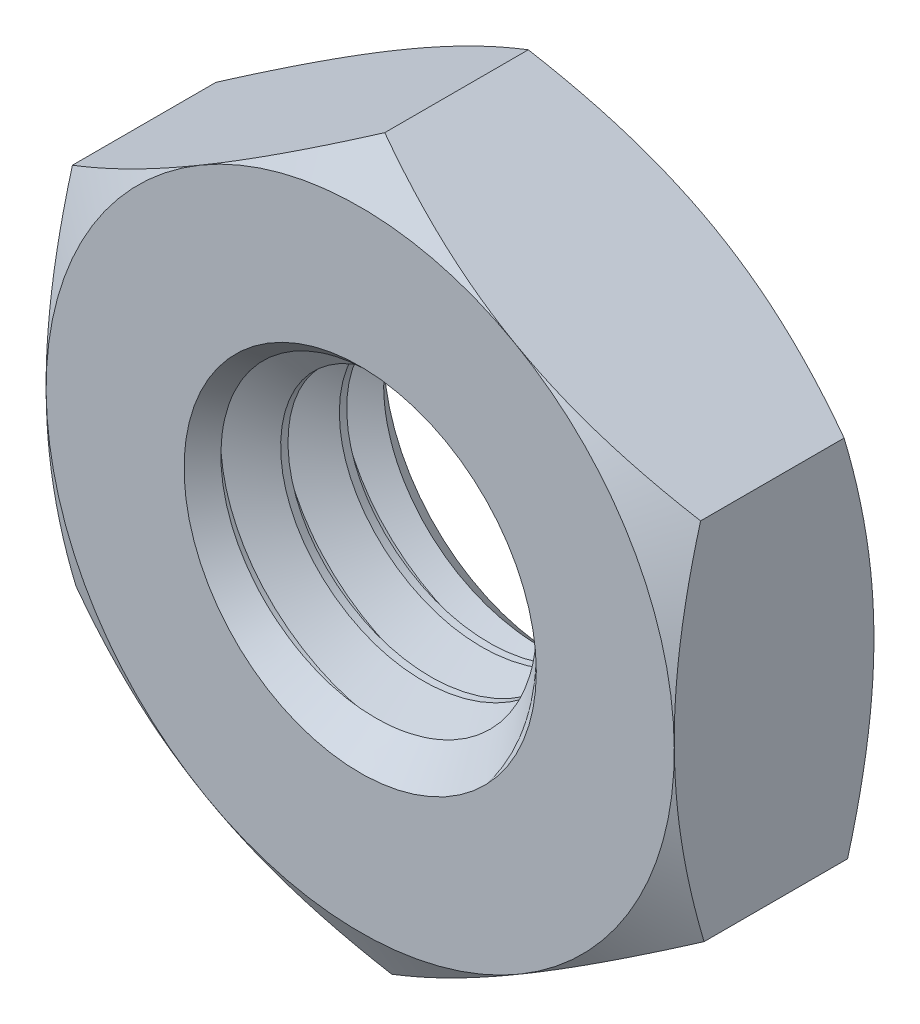
from build123d import *

# Parameters (mm, degrees)
BASE_DEPTH                                 = 0.85
SKETCH3_OUTSIDE_W                          = 14.942
SKETCH3_OUTSIDE_H                          = 15.74
SKETCH3_OUTSIDE_R                          = 2.675
POINT_ROUNDINGS_DEPTH                      = 1.7
POINT_ROUNDINGS_DRAFT                      = -60
SKETCH10_R                                 = 1.5
FUNNEL_CUT_DEPTH                           = 0.85
FUNNEL_CUT_DRAFT                           = -45
MIRROR_FOR_POINT_ROUNDINGS_COPY_1_SKETCH_W = 14.942
MIRROR_FOR_POINT_ROUNDINGS_COPY_1_SKETCH_H = 15.74
MIRROR_FOR_POINT_ROUNDINGS_COPY_1_SKETCH_R = 2.675
MIRROR_FOR_POINT_ROUNDINGS_COPY_1_DEPTH    = 1.7
MIRROR_FOR_POINT_ROUNDINGS_COPY_1_DRAFT    = -60
MIRROR_FOR_POINT_ROUNDINGS_COPY_2_SKETCH_R = 1.5
MIRROR_FOR_POINT_ROUNDINGS_COPY_2_DEPTH    = 0.85
MIRROR_FOR_POINT_ROUNDINGS_COPY_2_DRAFT    = -45
SKETCH4_R                                  = 1.5
PLUG_DEPTH                                 = 1.7
SWEEP_CUT_PITCH                            = 0.5


with BuildPart() as part:
    # Sketch1 → Base (new, symmetric)
    with BuildSketch(Plane.XY):
        Polygon((-2.689690292, 1.518683466), (-2.660063607, -1.569998388), (0.029626684, -3.088681854), (2.689690292, -1.518683466), (2.660063607, 1.569998388), (-0.029626684, 3.088681854), align=None)
    extrude(amount=BASE_DEPTH, both=True)


with BuildPart() as point_roundings_tool:
    # Sketch3 outside → Point roundings (with draft: the straight prism first)
    with BuildSketch(Plane.XY.offset(0.85)):
        Rectangle(SKETCH3_OUTSIDE_W, SKETCH3_OUTSIDE_H)
        Circle(SKETCH3_OUTSIDE_R, mode=Mode.SUBTRACT)
    extrude(amount=-POINT_ROUNDINGS_DEPTH)
    # Point roundings: the draft: its side faces are tilted about the plane it starts from
    point_roundings_sides = [point_roundings_tool.faces().sort_by_distance(p)[0] for p in [
        (0, -7.87, 0),
        (7.471, 0, 0),
        (0, 7.87, 0),
        (-7.471, 0, 0),
        (-2.675, 0, 0),
    ]]
    draft(point_roundings_sides, Plane.XY.offset(0.85), POINT_ROUNDINGS_DRAFT)


with BuildPart() as part_1:
    add(part.part)

    # Point roundings: cut by point_roundings_tool
    add(point_roundings_tool.part, mode=Mode.SUBTRACT)


with BuildPart() as funnel_cut_tool:
    # Sketch10 → Funnel cut (with draft: the straight prism first)
    with BuildSketch(Plane.XY.offset(0.85)):
        Circle(SKETCH10_R)
    extrude(amount=-FUNNEL_CUT_DEPTH)
    # Funnel cut: the draft: its side faces are tilted about the plane it starts from
    funnel_cut_sides = [funnel_cut_tool.faces().sort_by_distance(p)[0] for p in [
        (-1.5, 0, 0.425),
    ]]
    draft(funnel_cut_sides, Plane.XY.offset(0.85), FUNNEL_CUT_DRAFT)


with BuildPart() as part_2:
    add(part_1.part)

    # Funnel cut: cut by funnel_cut_tool
    add(funnel_cut_tool.part, mode=Mode.SUBTRACT)


with BuildPart() as mirror_for_point_roundings_copy_1_tool:
    # Mirror for point roundings copy 1 sketch → Mirror for point roundings copy 1 (with draft: the straight prism first)
    with BuildSketch(Plane(origin=(0, 0, -0.85), x_dir=(1, 0, 0), z_dir=(0, 0, -1))):
        Rectangle(MIRROR_FOR_POINT_ROUNDINGS_COPY_1_SKETCH_W, MIRROR_FOR_POINT_ROUNDINGS_COPY_1_SKETCH_H)
        Circle(MIRROR_FOR_POINT_ROUNDINGS_COPY_1_SKETCH_R, mode=Mode.SUBTRACT)
    extrude(amount=-MIRROR_FOR_POINT_ROUNDINGS_COPY_1_DEPTH)
    # Mirror for point roundings copy 1: the draft: its side faces are tilted about the plane it starts from
    mirror_for_point_roundings_copy_1_sides = [mirror_for_point_roundings_copy_1_tool.faces().sort_by_distance(p)[0] for p in [
        (0, -7.87, 0),
        (7.471, 0, 0),
        (0, 7.87, 0),
        (-7.471, 0, 0),
        (-2.675, 0, 0),
    ]]
    draft(mirror_for_point_roundings_copy_1_sides, Plane(origin=(0, 0, -0.85), x_dir=(1, 0, 0), z_dir=(0, 0, -1)), MIRROR_FOR_POINT_ROUNDINGS_COPY_1_DRAFT)


with BuildPart() as part_3:
    add(part_2.part)

    # Mirror for point roundings copy 1: cut by mirror_for_point_roundings_copy_1_tool
    add(mirror_for_point_roundings_copy_1_tool.part, mode=Mode.SUBTRACT)


with BuildPart() as mirror_for_point_roundings_copy_2_tool:
    # Mirror for point roundings copy 2 sketch → Mirror for point roundings copy 2 (with draft: the straight prism first)
    with BuildSketch(Plane(origin=(0, 0, -0.85), x_dir=(1, 0, 0), z_dir=(0, 0, -1))):
        Circle(MIRROR_FOR_POINT_ROUNDINGS_COPY_2_SKETCH_R)
    extrude(amount=-MIRROR_FOR_POINT_ROUNDINGS_COPY_2_DEPTH)
    # Mirror for point roundings copy 2: the draft: its side faces are tilted about the plane it starts from
    mirror_for_point_roundings_copy_2_sides = [mirror_for_point_roundings_copy_2_tool.faces().sort_by_distance(p)[0] for p in [
        (-1.5, 0, -0.425),
    ]]
    draft(mirror_for_point_roundings_copy_2_sides, Plane(origin=(0, 0, -0.85), x_dir=(1, 0, 0), z_dir=(0, 0, -1)), MIRROR_FOR_POINT_ROUNDINGS_COPY_2_DRAFT)


with BuildPart() as part_4:
    add(part_3.part)

    # Mirror for point roundings copy 2: cut by mirror_for_point_roundings_copy_2_tool
    add(mirror_for_point_roundings_copy_2_tool.part, mode=Mode.SUBTRACT)


with BuildPart() as body_2:
    # Sketch4 → Plug (new body)
    with BuildSketch(Plane.XY.offset(0.85)):
        Circle(SKETCH4_R)
    extrude(amount=-PLUG_DEPTH)

    # Sweep cut: the profile of Sketch7 profile screwed along a left-hand helix of 6.8 turns, 6 arcs to a turn; built about Z, then put on its axis
    sweep_cut_z = Axis((0, 0, 0), (0, 0, 1))
    sweep_cut_corners = [(1.5003, 0, 0.000173205), (1.5003, 0, -0.437673205), (1.175240474, 0, -0.25), (1.175240474, 0, -0.1875)]
    with BuildLine(mode=Mode.PRIVATE) as sweep_cut_profile:
        Line(sweep_cut_corners[0], sweep_cut_corners[1])
        Line(sweep_cut_corners[1], sweep_cut_corners[2])
        Line(sweep_cut_corners[2], sweep_cut_corners[3])
        Line(sweep_cut_corners[3], sweep_cut_corners[0])
    sweep_cut_cap = Face(sweep_cut_profile.wire())
    sweep_cut_turn_angles = [0, -30, -60, -90, -120, -150, -180, -210, -240, -270, -300, -330, -360]
    sweep_cut_turn_weights = [1, 0.8660254037844387, 1, 0.8660254037844387, 1, 0.8660254037844387, 1, 0.8660254037844387, 1, 0.8660254037844387, 1, 0.8660254037844387, 1]
    sweep_cut_turn_rails = [Edge.make_bspline([Vector(p[0], p[1], 0).rotate(sweep_cut_z, sweep_cut_turn_angles[k]) / sweep_cut_turn_weights[k] + Vector(0, 0, p[2] + -SWEEP_CUT_PITCH * sweep_cut_turn_angles[k] / 360) for k in range(13)], [0, 0, 0, 1, 1, 2, 2, 3, 3, 4, 4, 5, 5, 6, 6, 6], 2, sweep_cut_turn_weights) for p in sweep_cut_corners]
    sweep_cut_turn_sides = [Face.make_surface_from_curves(sweep_cut_turn_rails[p[0]], sweep_cut_turn_rails[p[1]]) for p in [(0, 1), (1, 2), (2, 3), (3, 0)]]
    sweep_cut_last_angles = [-2160, -2190, -2220, -2250, -2280, -2310, -2340, -2370, -2400, -2424, -2448]
    sweep_cut_last_weights = [1, 0.8660254037844387, 1, 0.8660254037844387, 1, 0.8660254037844387, 1, 0.8660254037844387, 1, 0.9135454576425863, 1]
    sweep_cut_last_rails = [Edge.make_bspline([Vector(p[0], p[1], 0).rotate(sweep_cut_z, sweep_cut_last_angles[k]) / sweep_cut_last_weights[k] + Vector(0, 0, p[2] + -SWEEP_CUT_PITCH * sweep_cut_last_angles[k] / 360) for k in range(11)], [0, 0, 0, 1, 1, 2, 2, 3, 3, 4, 4, 5, 5, 5], 2, sweep_cut_last_weights) for p in sweep_cut_corners]
    sweep_cut_last_sides = [Face.make_surface_from_curves(sweep_cut_last_rails[p[0]], sweep_cut_last_rails[p[1]]) for p in [(0, 1), (1, 2), (2, 3), (3, 0)]]
    sweep_cut = Plane(origin=(0, 0, 0.85), x_dir=(1, 0, 0), z_dir=(0, 0, -1)) * Solid(Shell([*[p.moved(Location((0, 0, SWEEP_CUT_PITCH * i))) for i in range(6) for p in sweep_cut_turn_sides], *sweep_cut_last_sides, sweep_cut_cap, sweep_cut_cap.rotate(sweep_cut_z, -2448).moved(Location((0, 0, -SWEEP_CUT_PITCH * -2448 / 360)))]))
    add(sweep_cut, mode=Mode.SUBTRACT)


with BuildPart() as part_5:
    add(part_4.part)

    # Combine: cut body 2
    add(body_2.part, mode=Mode.SUBTRACT)


solid = part_5.part
